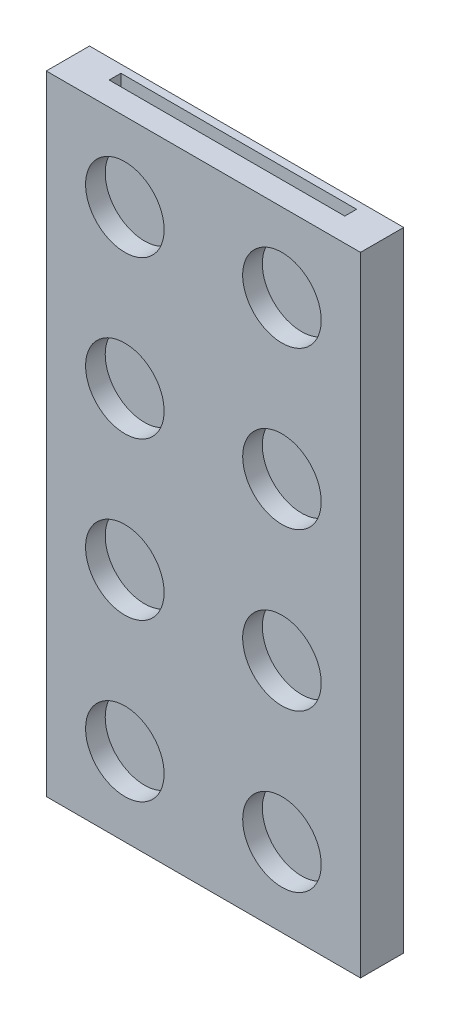
from build123d import *

# Parameters (mm, degrees)
SKETCH1_W           = 50.8
SKETCH1_H           = 101.6
BOSS_EXTRUDE1_DEPTH = 6.985
SKETCH3_R           = 6.35
SKETCH3_R_2         = 2.54
CUT_EXTRUDE2_DEPTH  = 3.175
SKETCH4_W           = 35.56
SKETCH4_H           = 86.36
CUT_EXTRUDE3_DEPTH  = 2.54
SKETCH5_W           = 38.1
SKETCH5_H           = 1.905
CUT_EXTRUDE4_DEPTH  = 95.25


with BuildPart() as part:
    # Sketch1 → Boss-Extrude1 (new body)
    with BuildSketch(Plane.XY):
        with Locations((25.4, 50.8)):
            Rectangle(SKETCH1_W, SKETCH1_H)
    extrude(amount=BOSS_EXTRUDE1_DEPTH)

    # Sketch3 → Cut-Extrude2 (cut)
    with BuildSketch(Plane.XY.offset(6.985)):
        with Locations((12.7, 139.7)):
            Circle(SKETCH3_R)
        with Locations((38.1, 139.7)):
            Circle(SKETCH3_R)
        with Locations((63.5, 139.7)):
            Circle(SKETCH3_R_2)
        with Locations((88.9, 139.7)):
            Circle(SKETCH3_R_2)
        with Locations((88.9, 114.3)):
            Circle(SKETCH3_R_2)
        with Locations((63.5, 114.3)):
            Circle(SKETCH3_R_2)
        with Locations((38.1, 114.3)):
            Circle(SKETCH3_R)
        with Locations((12.7, 114.3)):
            Circle(SKETCH3_R)
        with Locations((88.9, 88.9)):
            Circle(SKETCH3_R_2)
        with Locations((63.5, 88.9)):
            Circle(SKETCH3_R_2)
        with Locations((38.1, 88.9)):
            Circle(SKETCH3_R)
        with Locations((12.7, 88.9)):
            Circle(SKETCH3_R)
        with Locations((88.9, 63.5)):
            Circle(SKETCH3_R_2)
        with Locations((63.5, 63.5)):
            Circle(SKETCH3_R_2)
        with Locations((38.1, 63.5)):
            Circle(SKETCH3_R)
        with Locations((12.7, 63.5)):
            Circle(SKETCH3_R)
        with Locations((88.9, 38.1)):
            Circle(SKETCH3_R_2)
        with Locations((63.5, 38.1)):
            Circle(SKETCH3_R_2)
        with Locations((38.1, 38.1)):
            Circle(SKETCH3_R)
        with Locations((12.7, 38.1)):
            Circle(SKETCH3_R)
        with Locations((88.9, 12.7)):
            Circle(SKETCH3_R_2)
        with Locations((63.5, 12.7)):
            Circle(SKETCH3_R_2)
        with Locations((38.1, 12.7)):
            Circle(SKETCH3_R)
        with Locations((12.7, 12.7)):
            Circle(SKETCH3_R)
    extrude(amount=-CUT_EXTRUDE2_DEPTH, mode=Mode.SUBTRACT)

    # Sketch4 → Cut-Extrude3 (cut)
    with BuildSketch(Plane(origin=(0, 0, 0), x_dir=(-1, 0, 0), z_dir=(0, 0, -1))):
        with Locations((-25.4, 50.8)):
            Rectangle(SKETCH4_W, SKETCH4_H)
    extrude(amount=-CUT_EXTRUDE3_DEPTH, mode=Mode.SUBTRACT)

    # Sketch5 → Cut-Extrude4 (cut)
    with BuildSketch(Plane(origin=(0, 101.6, 0), x_dir=(1, 0, 0), z_dir=(0, 1, 0))):
        with Locations((25.4, -2.2225)):
            Rectangle(SKETCH5_W, SKETCH5_H)
    extrude(amount=-CUT_EXTRUDE4_DEPTH, mode=Mode.SUBTRACT)


solid = part.part
